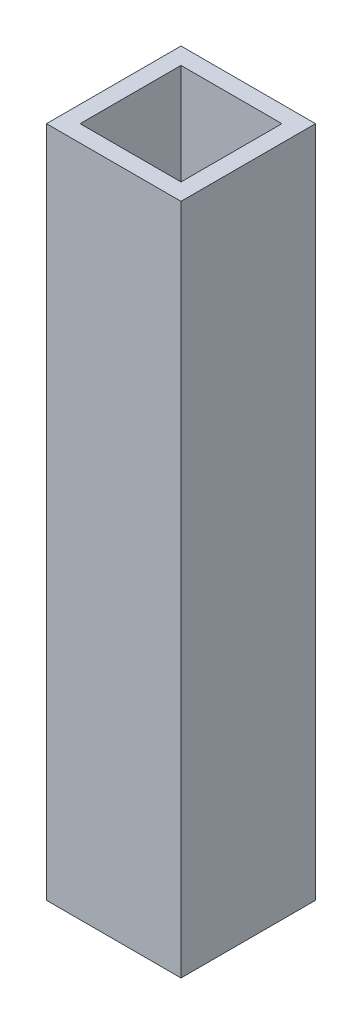
from build123d import *

# Parameters (mm, degrees)
SKETCH1_W           = 25.4
SKETCH1_H           = 25.4
SKETCH1_W_2         = 19.05
SKETCH1_H_2         = 19.05
EXTRUDE_THIN1_DEPTH = 127


with BuildPart() as part:
    # Sketch1 → Extrude-Thin1 (new body)
    with BuildSketch(Plane(origin=(0, 0, 0), x_dir=(1, 0, 0), z_dir=(0, 1, 0))):
        Rectangle(SKETCH1_W, SKETCH1_H)
        Rectangle(SKETCH1_W_2, SKETCH1_H_2, mode=Mode.SUBTRACT)
    extrude(amount=EXTRUDE_THIN1_DEPTH)


solid = part.part
